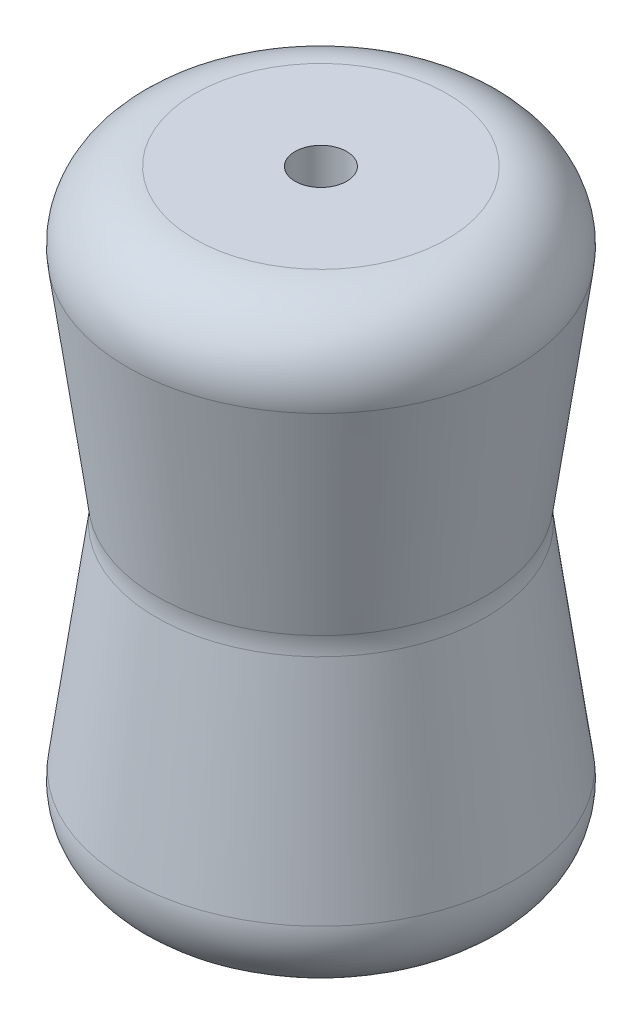
from build123d import *

# Parameters (mm, degrees)
SKETCH_3_R          = 1.9
CUT_EXTRUDE_1_DEPTH = 60
FILLET_1_R          = 5


with BuildPart() as part:
    # 草图2 → 旋转1 (revolve)
    with BuildSketch(Plane.XY):
        Polygon((-15, 0), (0, 0), (0, 44), (-15, 44), (-12, 22), align=None)
    revolve(axis=Axis((0, 0, 0), (0, 1, 0)))

    # 草图3 → 切除-拉伸1 (cut)
    with BuildSketch(Plane.XZ):
        Circle(SKETCH_3_R)
    extrude(amount=-CUT_EXTRUDE_1_DEPTH, mode=Mode.SUBTRACT)

    # 圆角1
    fillet_1_edges = [part.edges().sort_by_distance(p)[0] for p in [
        (15, 0, 0),
        (12, 22, 0),
        (15, 44, 0),
    ]]
    fillet(fillet_1_edges, radius=FILLET_1_R)


solid = part.part
